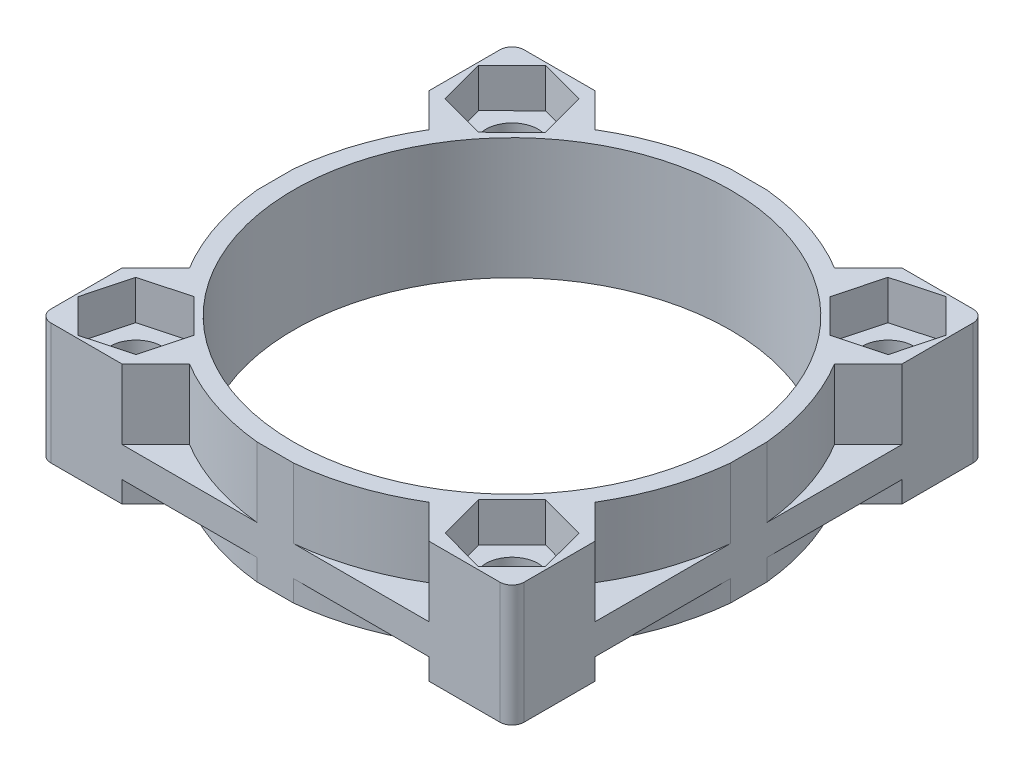
from build123d import *

# Parameters (mm, degrees)
SKETCH1_W                      = 39
SKETCH1_H                      = 39
BOSS_EXTRUDE1_DEPTH            = 10
CUT_EXTRUDE1_DEPTH             = 5.75
CUT_EXTRUDE2_START             = -1.75
CUT_EXTRUDE2_DEPTH             = 1.75
CUT_EXTRUDE3_DEPTH             = 1.75
CUT_EXTRUDE4_START             = -5.75
CUT_EXTRUDE4_DEPTH             = 5.75
CUT_EXTRUDE5_START             = -1.75
CUT_EXTRUDE5_DEPTH             = 1.75
CUT_EXTRUDE6_DEPTH             = 5.75
CUT_EXTRUDE7_DEPTH             = 5.75
CUT_EXTRUDE8_START             = -1.75
CUT_EXTRUDE8_DEPTH             = 1.75
CUT_EXTRUDE9_START             = -1.75
CUT_EXTRUDE9_DEPTH             = 1.75
CUT_EXTRUDE10_DEPTH            = 5.75
CUT_EXTRUDE11_DEPTH            = 5.75
CUT_EXTRUDE12_START            = -1.75
CUT_EXTRUDE12_DEPTH            = 1.75
CUT_EXTRUDE13_START            = -5.75
CUT_EXTRUDE13_DEPTH            = 5.75
CUT_EXTRUDE14_DEPTH            = 1.75
CUT_EXTRUDE15_START            = -1.75
CUT_EXTRUDE15_DEPTH            = 1.75
CUT_EXTRUDE16_DEPTH            = 5.75
CUT_EXTRUDE17_DEPTH            = 2.21
CUT_EXTRUDE18_DEPTH            = 2.21
CUT_EXTRUDE19_DEPTH            = 2.21
CUT_EXTRUDE20_DEPTH            = 2.21
CUT_EXTRUDE21_DEPTH            = 3.24
CUT_EXTRUDE22_DEPTH            = 3.24
CUT_EXTRUDE23_DEPTH            = 3.24
CUT_EXTRUDE24_DEPTH            = 3.24
M33_CLEARANCE_HOLE1_D          = 36
F_4_3_4_3_DIAMETER_HOLE1_D     = 4.3
F_4_3_4_3_DIAMETER_HOLE1_DEPTH = 7.79
FILLET1_R                      = 1


with BuildPart() as part:
    # Sketch1 → Boss-Extrude1 (new body)
    with BuildSketch(Plane.XZ.offset(-35.380317461)):
        with Locations((518.057774839, 801.49174641)):
            Rectangle(SKETCH1_W, SKETCH1_H)
    extrude(amount=-BOSS_EXTRUDE1_DEPTH)

    # Sketch2 → Cut-Extrude1 (cut)
    with BuildSketch(Plane(origin=(0, 45.380317461, 0), x_dir=(-1, 0, 0), z_dir=(0, 1, 0))):
        with BuildLine():
            Line((-505.395497413, 781.99174641), (-508.181115567, 784.777364563))
            ThreePointArc((-508.181115567, 784.777364563), (-512.213422741, 782.919274193), (-516.555276399, 781.99174641))
            Line((-516.555276399, 781.99174641), (-505.395497413, 781.99174641))
        make_face()
    extrude(amount=-CUT_EXTRUDE1_DEPTH, mode=Mode.SUBTRACT)

    # Sketch3 → Cut-Extrude2 (cut)
    with BuildSketch(Plane.XZ.offset(-35.380317461).offset(CUT_EXTRUDE2_START)):
        with BuildLine():
            Line((508.181115567, 784.777364563), (505.395497413, 781.99174641))
            Line((505.395497413, 781.99174641), (516.555276399, 781.99174641))
            ThreePointArc((516.555276399, 781.99174641), (512.213422741, 782.919274193), (508.181115567, 784.777364563))
        make_face()
    extrude(amount=CUT_EXTRUDE2_DEPTH, mode=Mode.SUBTRACT)

    # Sketch4 → Cut-Extrude3 (cut)
    with BuildSketch(Plane.XZ.offset(-35.380317461)):
        with BuildLine():
            Line((530.720052265, 781.99174641), (527.934434111, 784.777364563))
            ThreePointArc((527.934434111, 784.777364563), (523.902126936, 782.919274193), (519.560273278, 781.99174641))
            Line((519.560273278, 781.99174641), (530.720052265, 781.99174641))
        make_face()
    extrude(amount=-CUT_EXTRUDE3_DEPTH, mode=Mode.SUBTRACT)

    # Sketch5 → Cut-Extrude4 (cut)
    with BuildSketch(Plane(origin=(0, 45.380317461, 0), x_dir=(-1, 0, 0), z_dir=(0, 1, 0)).offset(CUT_EXTRUDE4_START)):
        with BuildLine():
            Line((-527.934434111, 784.777364563), (-530.720052265, 781.99174641))
            Line((-530.720052265, 781.99174641), (-519.560273278, 781.99174641))
            ThreePointArc((-519.560273278, 781.99174641), (-523.902126936, 782.919274193), (-527.934434111, 784.777364563))
        make_face()
    extrude(amount=CUT_EXTRUDE4_DEPTH, mode=Mode.SUBTRACT)

    # Sketch6 → Cut-Extrude5 (cut)
    with BuildSketch(Plane.XZ.offset(-35.380317461).offset(CUT_EXTRUDE5_START)):
        with BuildLine():
            Line((498.557774839, 788.829468984), (501.343392993, 791.615087137))
            ThreePointArc((501.343392993, 791.615087137), (499.485302622, 795.647394312), (498.557774839, 799.98924797))
            Line((498.557774839, 799.98924797), (498.557774839, 788.829468984))
        make_face()
    extrude(amount=CUT_EXTRUDE5_DEPTH, mode=Mode.SUBTRACT)

    # Sketch7 → Cut-Extrude6 (cut)
    with BuildSketch(Plane(origin=(0, 45.380317461, 0), x_dir=(-1, 0, 0), z_dir=(0, 1, 0))):
        with BuildLine():
            Line((-501.343392993, 791.615087137), (-498.557774839, 788.829468984))
            Line((-498.557774839, 788.829468984), (-498.557774839, 799.98924797))
            ThreePointArc((-498.557774839, 799.98924797), (-499.485302622, 795.647394312), (-501.343392993, 791.615087137))
        make_face()
    extrude(amount=-CUT_EXTRUDE6_DEPTH, mode=Mode.SUBTRACT)

    # Sketch8 → Cut-Extrude7 (cut)
    with BuildSketch(Plane(origin=(0, 45.380317461, 0), x_dir=(-1, 0, 0), z_dir=(0, 1, 0))):
        with BuildLine():
            Line((-498.557774839, 814.154023836), (-501.330546311, 811.347063751))
            ThreePointArc((-501.330546311, 811.347063751), (-499.481374972, 807.32427893), (-498.557774839, 802.994244849))
            Line((-498.557774839, 802.994244849), (-498.557774839, 814.154023836))
        make_face()
    extrude(amount=-CUT_EXTRUDE7_DEPTH, mode=Mode.SUBTRACT)

    # Sketch9 → Cut-Extrude8 (cut)
    with BuildSketch(Plane.XZ.offset(-35.380317461).offset(CUT_EXTRUDE8_START)):
        with BuildLine():
            Line((501.330546311, 811.347063751), (498.557774839, 814.154023836))
            Line((498.557774839, 814.154023836), (498.557774839, 802.994244849))
            ThreePointArc((498.557774839, 802.994244849), (499.481374972, 807.32427893), (501.330546311, 811.347063751))
        make_face()
    extrude(amount=CUT_EXTRUDE8_DEPTH, mode=Mode.SUBTRACT)

    # Sketch10 → Cut-Extrude9 (cut)
    with BuildSketch(Plane.XZ.offset(-35.380317461).offset(CUT_EXTRUDE9_START)):
        with BuildLine():
            Line((505.395497413, 820.99174641), (508.181115567, 818.206128256))
            ThreePointArc((508.181115567, 818.206128256), (512.213422741, 820.064218627), (516.555276399, 820.99174641))
            Line((516.555276399, 820.99174641), (505.395497413, 820.99174641))
        make_face()
    extrude(amount=CUT_EXTRUDE9_DEPTH, mode=Mode.SUBTRACT)

    # Sketch11 → Cut-Extrude10 (cut)
    with BuildSketch(Plane(origin=(0, 45.380317461, 0), x_dir=(-1, 0, 0), z_dir=(0, 1, 0))):
        with BuildLine():
            Line((-508.181115567, 818.206128256), (-505.395497413, 820.99174641))
            Line((-505.395497413, 820.99174641), (-516.555276399, 820.99174641))
            ThreePointArc((-516.555276399, 820.99174641), (-512.213422741, 820.064218627), (-508.181115567, 818.206128256))
        make_face()
    extrude(amount=-CUT_EXTRUDE10_DEPTH, mode=Mode.SUBTRACT)

    # Sketch12 → Cut-Extrude11 (cut)
    with BuildSketch(Plane(origin=(0, 45.380317461, 0), x_dir=(-1, 0, 0), z_dir=(0, 1, 0))):
        with BuildLine():
            Line((-530.720052265, 820.99174641), (-527.934434111, 818.206128256))
            ThreePointArc((-527.934434111, 818.206128256), (-523.902126936, 820.064218627), (-519.560273278, 820.99174641))
            Line((-519.560273278, 820.99174641), (-530.720052265, 820.99174641))
        make_face()
    extrude(amount=-CUT_EXTRUDE11_DEPTH, mode=Mode.SUBTRACT)

    # Sketch13 → Cut-Extrude12 (cut)
    with BuildSketch(Plane.XZ.offset(-35.380317461).offset(CUT_EXTRUDE12_START)):
        with BuildLine():
            Line((527.934434111, 818.206128256), (530.720052265, 820.99174641))
            Line((530.720052265, 820.99174641), (519.560273278, 820.99174641))
            ThreePointArc((519.560273278, 820.99174641), (523.902126936, 820.064218627), (527.934434111, 818.206128256))
        make_face()
    extrude(amount=CUT_EXTRUDE12_DEPTH, mode=Mode.SUBTRACT)

    # Sketch14 → Cut-Extrude13 (cut)
    with BuildSketch(Plane(origin=(0, 45.380317461, 0), x_dir=(-1, 0, 0), z_dir=(0, 1, 0)).offset(CUT_EXTRUDE13_START)):
        with BuildLine():
            Line((-537.557774839, 788.829468984), (-534.772156685, 791.615087137))
            ThreePointArc((-534.772156685, 791.615087137), (-536.630247056, 795.647394312), (-537.557774839, 799.98924797))
            Line((-537.557774839, 799.98924797), (-537.557774839, 788.829468984))
        make_face()
    extrude(amount=CUT_EXTRUDE13_DEPTH, mode=Mode.SUBTRACT)

    # Sketch15 → Cut-Extrude14 (cut)
    with BuildSketch(Plane.XZ.offset(-35.380317461)):
        with BuildLine():
            Line((534.772156685, 791.615087137), (537.557774839, 788.829468984))
            Line((537.557774839, 788.829468984), (537.557774839, 799.98924797))
            ThreePointArc((537.557774839, 799.98924797), (536.630247056, 795.647394312), (534.772156685, 791.615087137))
        make_face()
    extrude(amount=-CUT_EXTRUDE14_DEPTH, mode=Mode.SUBTRACT)

    # Sketch16 → Cut-Extrude15 (cut)
    with BuildSketch(Plane.XZ.offset(-35.380317461).offset(CUT_EXTRUDE15_START)):
        with BuildLine():
            Line((537.557774839, 814.154023836), (534.772156685, 811.368405682))
            ThreePointArc((534.772156685, 811.368405682), (536.630247056, 807.336098507), (537.557774839, 802.994244849))
            Line((537.557774839, 802.994244849), (537.557774839, 814.154023836))
        make_face()
    extrude(amount=CUT_EXTRUDE15_DEPTH, mode=Mode.SUBTRACT)

    # Sketch17 → Cut-Extrude16 (cut)
    with BuildSketch(Plane(origin=(0, 45.380317461, 0), x_dir=(-1, 0, 0), z_dir=(0, 1, 0))):
        with BuildLine():
            Line((-534.772156685, 811.368405682), (-537.557774839, 814.154023836))
            Line((-537.557774839, 814.154023836), (-537.557774839, 802.994244849))
            ThreePointArc((-537.557774839, 802.994244849), (-536.630247056, 807.336098507), (-534.772156685, 811.368405682))
        make_face()
    extrude(amount=-CUT_EXTRUDE16_DEPTH, mode=Mode.SUBTRACT)

    # Sketch18 → Cut-Extrude17 (cut)
    with BuildSketch(Plane.XZ.offset(-35.380317461)):
        Polygon((536.323636481, 814.240638531), (537.323234972, 818.011498916), (534.557373329, 820.762606795), (530.791913196, 819.742854289), (529.792314706, 815.971993903), (532.558176349, 813.220886024), align=None)
    extrude(amount=-CUT_EXTRUDE17_DEPTH, mode=Mode.SUBTRACT)

    # Sketch19 → Cut-Extrude18 (cut)
    with BuildSketch(Plane.XZ.offset(-35.380317461)):
        Polygon((498.792314706, 818.011498916), (499.791913196, 814.240638531), (503.557373329, 813.220886024), (506.323234972, 815.971993903), (505.323636481, 819.742854289), (501.558176349, 820.762606795), align=None)
    extrude(amount=-CUT_EXTRUDE18_DEPTH, mode=Mode.SUBTRACT)

    # Sketch20 → Cut-Extrude19 (cut)
    with BuildSketch(Plane.XZ.offset(-35.380317461)):
        Polygon((499.791913196, 788.742854289), (498.792314706, 784.971993903), (501.558176349, 782.220886024), (505.323636481, 783.240638531), (506.323234972, 787.011498916), (503.557373329, 789.762606795), align=None)
    extrude(amount=-CUT_EXTRUDE19_DEPTH, mode=Mode.SUBTRACT)

    # Sketch21 → Cut-Extrude20 (cut)
    with BuildSketch(Plane.XZ.offset(-35.380317461)):
        Polygon((537.323234972, 784.971993903), (536.323636481, 788.742854289), (532.558176349, 789.762606795), (529.792314706, 787.011498916), (530.791913196, 783.240638531), (534.557373329, 782.220886024), align=None)
    extrude(amount=-CUT_EXTRUDE20_DEPTH, mode=Mode.SUBTRACT)

    # Sketch22 → Cut-Extrude21 (cut)
    with BuildSketch(Plane(origin=(0, 45.380317461, 0), x_dir=(-1, 0, 0), z_dir=(0, 1, 0))):
        Polygon((-529.792314706, 787.011498916), (-532.558176349, 789.762606795), (-536.323636481, 788.742854289), (-537.323234972, 784.971993903), (-534.557373329, 782.220886024), (-530.791913196, 783.240638531), align=None)
    extrude(amount=-CUT_EXTRUDE21_DEPTH, mode=Mode.SUBTRACT)

    # Sketch23 → Cut-Extrude22 (cut)
    with BuildSketch(Plane(origin=(0, 45.380317461, 0), x_dir=(-1, 0, 0), z_dir=(0, 1, 0))):
        Polygon((-503.557373329, 789.762606795), (-506.323234972, 787.011498916), (-505.323636481, 783.240638531), (-501.558176349, 782.220886024), (-498.792314706, 784.971993903), (-499.791913196, 788.742854289), align=None)
    extrude(amount=-CUT_EXTRUDE22_DEPTH, mode=Mode.SUBTRACT)

    # Sketch24 → Cut-Extrude23 (cut)
    with BuildSketch(Plane(origin=(0, 45.380317461, 0), x_dir=(-1, 0, 0), z_dir=(0, 1, 0))):
        Polygon((-506.323234972, 815.971993903), (-503.557373329, 813.220886024), (-499.791913196, 814.240638531), (-498.792314706, 818.011498916), (-501.558176349, 820.762606795), (-505.323636481, 819.742854289), align=None)
    extrude(amount=-CUT_EXTRUDE23_DEPTH, mode=Mode.SUBTRACT)

    # Sketch25 → Cut-Extrude24 (cut)
    with BuildSketch(Plane(origin=(0, 45.380317461, 0), x_dir=(-1, 0, 0), z_dir=(0, 1, 0))):
        Polygon((-532.558176349, 813.220886024), (-529.792314706, 815.971993903), (-530.791913196, 819.742854289), (-534.557373329, 820.762606795), (-537.323234972, 818.011498916), (-536.323636481, 814.240638531), align=None)
    extrude(amount=-CUT_EXTRUDE24_DEPTH, mode=Mode.SUBTRACT)

    # M33 Clearance Hole1 (through all)
    with Locations(Plane(origin=(0, 35.380317461, 0), x_dir=(-1, 0, 0), z_dir=(0, -1, 0))):
        with Locations((-518.057774839, -801.49174641)):
            Hole(M33_CLEARANCE_HOLE1_D / 2)

    # Ø4.3 (4.3) Diameter Hole1
    with Locations(Plane(origin=(0, 37.590317461, 0), x_dir=(-1, 0, 0), z_dir=(0, -1, 0))):
        with Locations((-533.557774839, -785.99174641), (-502.557774839, -785.99174641), (-502.557774839, -816.99174641), (-533.557774839, -816.99174641)):
            Hole(F_4_3_4_3_DIAMETER_HOLE1_D / 2, depth=F_4_3_4_3_DIAMETER_HOLE1_DEPTH)

    # Fillet1
    fillet1_edges = [part.edges().sort_by_distance(p)[0] for p in [
        (498.557774839, 40.380317461, 820.99174641),
        (537.557774839, 40.380317461, 820.99174641),
        (537.557774839, 40.380317461, 781.99174641),
        (498.557774839, 40.380317461, 781.99174641),
    ]]
    fillet(fillet1_edges, radius=FILLET1_R)


solid = part.part
